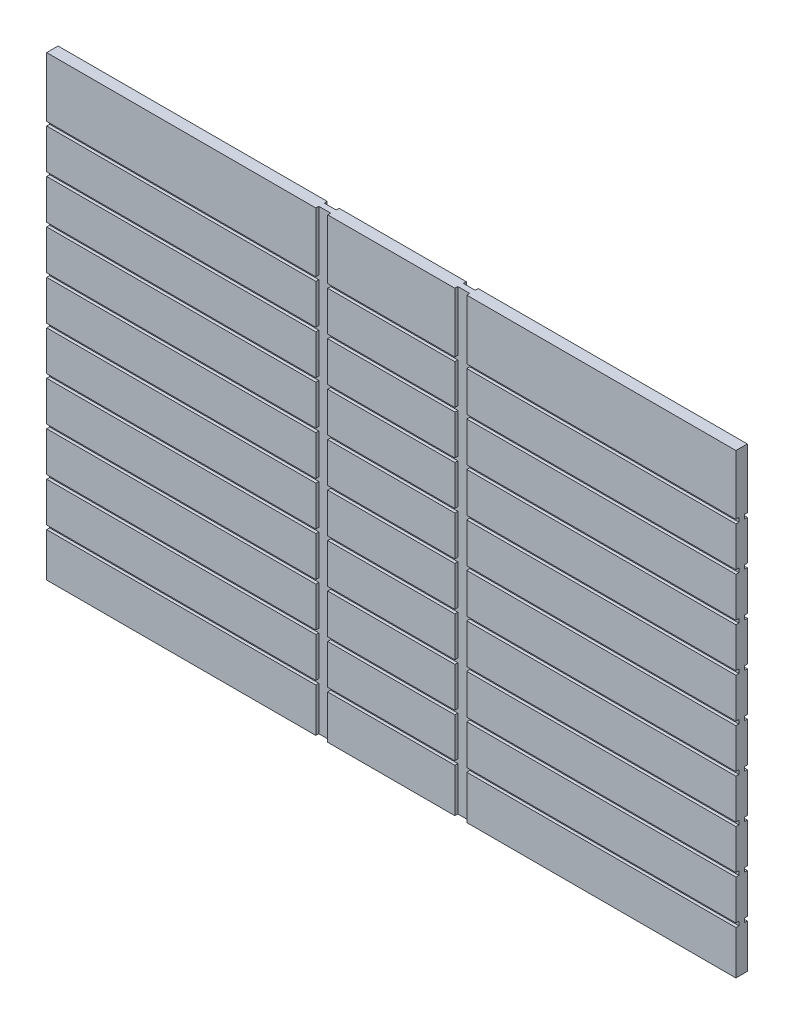
from build123d import *

# Parameters (mm, degrees)
PARTSCAB_REFERENCE_START = -1615.650675561
PARTSCAB_REFERENCE_DEPTH = 1475.316666667
SKETCH1_OUTSIDE_W        = 1806.569
SKETCH1_OUTSIDE_H        = 1061.502
SKETCH1_OUTSIDE_W_2      = 1101.725
SKETCH1_OUTSIDE_H_2      = 730.25
CUT_EXTRUDE1_DEPTH       = 1820.964329577
SKETCH4_W                = 19.05
SKETCH4_H                = 4.7625
CUT_EXTRUDE2_DEPTH       = 1441.853872554
SKETCH5_W                = 19.05
SKETCH5_H                = 4.7625
CUT_EXTRUDE3_DEPTH       = 1441.853872554
SKETCH6_W                = 19.05
SKETCH6_H                = 4.7625
CUT_EXTRUDE4_DEPTH       = 1441.853872554


# Read off the part's stored shape, not the designer's step: PartsCab_Reference
with BuildPart() as part:
    # PartsCab_Reference outline → PartsCab_Reference (new body)
    with BuildSketch(Plane.YZ.offset(PARTSCAB_REFERENCE_START)):
        Polygon((107.371492578, 9.178125), (107.371492578, -9.078125), (177.221492578, -9.078125), (177.221492578, -4.315625), (183.571492578, -4.315625), (183.571492578, -9.078125), (247.071492578, -9.078125), (247.071492578, -4.315625), (253.421492578, -4.315625), (253.421492578, -9.078125), (316.921492578, -9.078125), (316.921492578, -4.315625), (323.271492578, -4.315625), (323.271492578, -9.078125), (386.771492578, -9.078125), (386.771492578, -4.315625), (393.121492578, -4.315625), (393.121492578, -9.078125), (456.621492578, -9.078125), (456.621492578, -4.315625), (462.971492578, -4.315625), (462.971492578, -9.078125), (526.471492578, -9.078125), (526.471492578, -4.315625), (532.821492578, -4.315625), (532.821492578, -9.078125), (596.321492578, -9.078125), (596.321492578, -4.315625), (602.671492578, -4.315625), (602.671492578, -9.078125), (666.171492578, -9.078125), (666.171492578, -4.315625), (672.521492578, -4.315625), (672.521492578, -9.078125), (736.021492578, -9.078125), (736.021492578, -4.315625), (742.371492578, -4.315625), (742.371492578, -9.078125), (837.621492578, -9.078125), (837.621492578, 9.178125), (742.371492578, 9.178125), (742.371492578, 4.415625), (736.021492578, 4.415625), (736.021492578, 9.178125), (672.521492578, 9.178125), (672.521492578, 4.415625), (666.171492578, 4.415625), (666.171492578, 9.178125), (602.671492578, 9.178125), (602.671492578, 4.415625), (596.321492578, 4.415625), (596.321492578, 9.178125), (532.821492578, 9.178125), (532.821492578, 4.415625), (526.471492578, 4.415625), (526.471492578, 9.178125), (462.971492578, 9.178125), (462.971492578, 4.415625), (456.621492578, 4.415625), (456.621492578, 9.178125), (393.121492578, 9.178125), (393.121492578, 4.415625), (386.771492578, 4.415625), (386.771492578, 9.178125), (323.271492578, 9.178125), (323.271492578, 4.415625), (316.921492578, 4.415625), (316.921492578, 9.178125), (253.421492578, 9.178125), (253.421492578, 4.415625), (247.071492578, 4.415625), (247.071492578, 9.178125), (183.571492578, 9.178125), (183.571492578, 4.415625), (177.221492578, 4.415625), (177.221492578, 9.178125), align=None)
    extrude(amount=PARTSCAB_REFERENCE_DEPTH)

    # Sketch1 outside → Cut-Extrude1 (cut, through all)
    with BuildSketch(Plane.XY.offset(9.178125)):
        with Locations((-877.9925, 472.496)):
            Rectangle(SKETCH1_OUTSIDE_W, SKETCH1_OUTSIDE_H)
        with Locations((-691.196508894, 472.496492578)):
            Rectangle(SKETCH1_OUTSIDE_W_2, SKETCH1_OUTSIDE_H_2, mode=Mode.SUBTRACT)
    extrude(amount=-CUT_EXTRUDE1_DEPTH, mode=Mode.SUBTRACT)

    # Sketch4 → Cut-Extrude2 (cut, through all)
    with BuildSketch(Plane(origin=(0, 837.621492578, 0), x_dir=(1, 0, 0), z_dir=(0, 1, 0))):
        with Locations((-580.074048894, -6.796875)):
            Rectangle(SKETCH4_W, SKETCH4_H)
    extrude(amount=-CUT_EXTRUDE2_DEPTH, mode=Mode.SUBTRACT)

    # Sketch5 → Cut-Extrude3 (cut, through all)
    with BuildSketch(Plane(origin=(0, 837.621492578, 0), x_dir=(1, 0, 0), z_dir=(0, 1, 0))):
        with Locations((-802.318968894, -6.796875)):
            Rectangle(SKETCH5_W, SKETCH5_H)
        with Locations((-802.318968894, 6.696875)):
            Rectangle(SKETCH5_W, SKETCH5_H)
    extrude(amount=-CUT_EXTRUDE3_DEPTH, mode=Mode.SUBTRACT)

    # Sketch6 → Cut-Extrude4 (cut, through all)
    with BuildSketch(Plane(origin=(0, 837.621492578, 0), x_dir=(1, 0, 0), z_dir=(0, 1, 0))):
        with Locations((-580.074048894, 6.696875)):
            Rectangle(SKETCH6_W, SKETCH6_H)
    extrude(amount=-CUT_EXTRUDE4_DEPTH, mode=Mode.SUBTRACT)


solid = part.part
